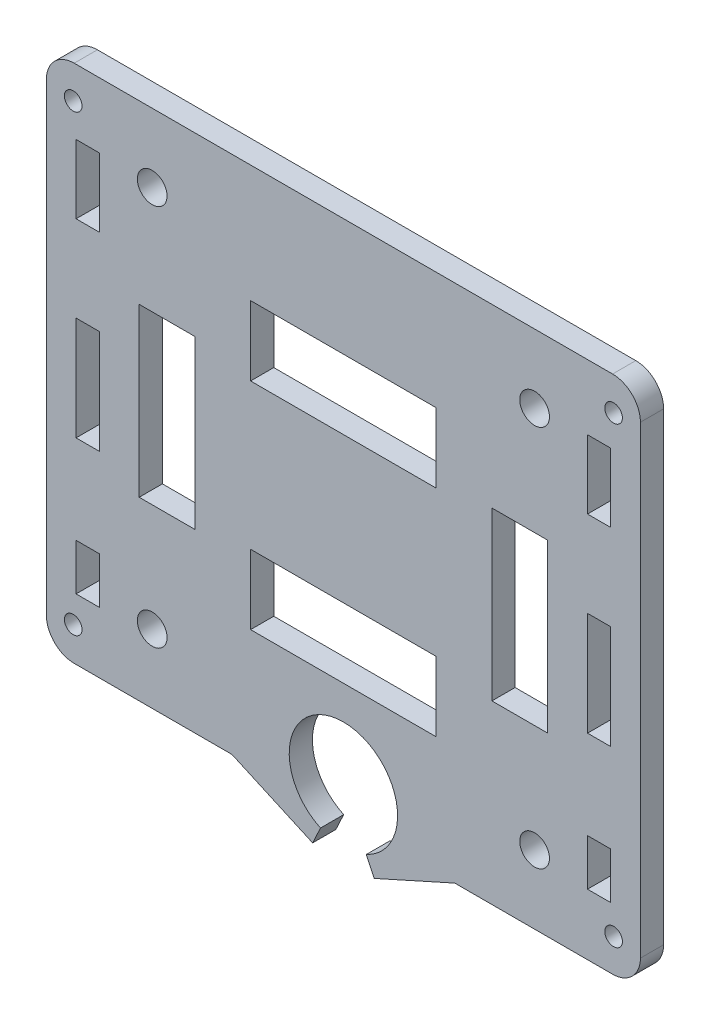
from build123d import *

# Parameters (mm, degrees)
SKETCH1_R           = 0.60325
SKETCH1_W           = 1.5875
SKETCH1_H           = 3.175
SKETCH1_R_2         = 1.016
SKETCH1_W_2         = 12.7
SKETCH1_H_2         = 4.7625
SKETCH1_H_3         = 7.0993
SKETCH1_W_3         = 3.81
SKETCH1_H_4         = 11.43
SKETCH1_H_5         = 4.699
BOSS_EXTRUDE1_DEPTH = 1.5875


with BuildPart() as part:
    # Sketch1 → Boss-Extrude1 (new body)
    with BuildSketch(Plane.XY):
        with BuildLine():
            ThreePointArc((20.32, 15.875), (19.762038418, 17.222038418), (18.415, 17.78))
            Line((18.415, 17.78), (-18.415, 17.78))
            ThreePointArc((-18.415, 17.78), (-19.762038418, 17.222038418), (-20.32, 15.875))
            Line((-20.32, 15.875), (-20.32, -15.875))
            ThreePointArc((-20.32, -15.875), (-19.762038418, -17.222038418), (-18.415, -17.78))
            Line((-18.415, -17.78), (-7.62, -17.78))
            Line((-7.62, -17.78), (-2.103962754, -20.259962687))
            Line((-2.103962754, -20.259962687), (-1.567237562, -19.108951797))
            ThreePointArc((-1.567237562, -19.108951797), (0, -12.0396), (1.567237562, -19.108951797))
            Line((1.567237562, -19.108951797), (2.103962754, -20.259962687))
            Line((2.103962754, -20.259962687), (7.62, -17.78))
            Line((7.62, -17.78), (18.415, -17.78))
            ThreePointArc((18.415, -17.78), (19.762038418, -17.222038418), (20.32, -15.875))
            Line((20.32, -15.875), (20.32, 15.875))
        make_face()
        with Locations((-18.484652412, -15.510465022)):
            Circle(SKETCH1_R, mode=Mode.SUBTRACT)
        with Locations((-17.49425, -12.012463634)):
            Rectangle(SKETCH1_W, SKETCH1_H, mode=Mode.SUBTRACT)
        with Locations((-13.08, -13.08)):
            Circle(SKETCH1_R_2, mode=Mode.SUBTRACT)
        with Locations((13.08, -13.08)):
            Circle(SKETCH1_R_2, mode=Mode.SUBTRACT)
        with Locations((18.484652412, -15.510465022)):
            Circle(SKETCH1_R, mode=Mode.SUBTRACT)
        with Locations((17.49425, -12.012463634)):
            Rectangle(SKETCH1_W, SKETCH1_H, mode=Mode.SUBTRACT)
        with Locations((0, -7.366)):
            Rectangle(SKETCH1_W_2, SKETCH1_H_2, mode=Mode.SUBTRACT)
        with Locations((-17.49425, -0.80645)):
            Rectangle(SKETCH1_W, SKETCH1_H_3, mode=Mode.SUBTRACT)
        with Locations((-12.065, 0)):
            Rectangle(SKETCH1_W_3, SKETCH1_H_4, mode=Mode.SUBTRACT)
        with Locations((-17.49425, 10.974536366)):
            Rectangle(SKETCH1_W, SKETCH1_H_5, mode=Mode.SUBTRACT)
        with Locations((-18.484652412, 15.510465022)):
            Circle(SKETCH1_R, mode=Mode.SUBTRACT)
        with Locations((-13.08, 13.08)):
            Circle(SKETCH1_R_2, mode=Mode.SUBTRACT)
        with Locations((0, 7.366)):
            Rectangle(SKETCH1_W_2, SKETCH1_H_2, mode=Mode.SUBTRACT)
        with Locations((12.065, 0)):
            Rectangle(SKETCH1_W_3, SKETCH1_H_4, mode=Mode.SUBTRACT)
        with Locations((17.49425, -0.80645)):
            Rectangle(SKETCH1_W, SKETCH1_H_3, mode=Mode.SUBTRACT)
        with Locations((17.49425, 10.974536366)):
            Rectangle(SKETCH1_W, SKETCH1_H_5, mode=Mode.SUBTRACT)
        with Locations((13.08, 13.08)):
            Circle(SKETCH1_R_2, mode=Mode.SUBTRACT)
        with Locations((18.484652412, 15.510465022)):
            Circle(SKETCH1_R, mode=Mode.SUBTRACT)
    extrude(amount=BOSS_EXTRUDE1_DEPTH)


solid = part.part
